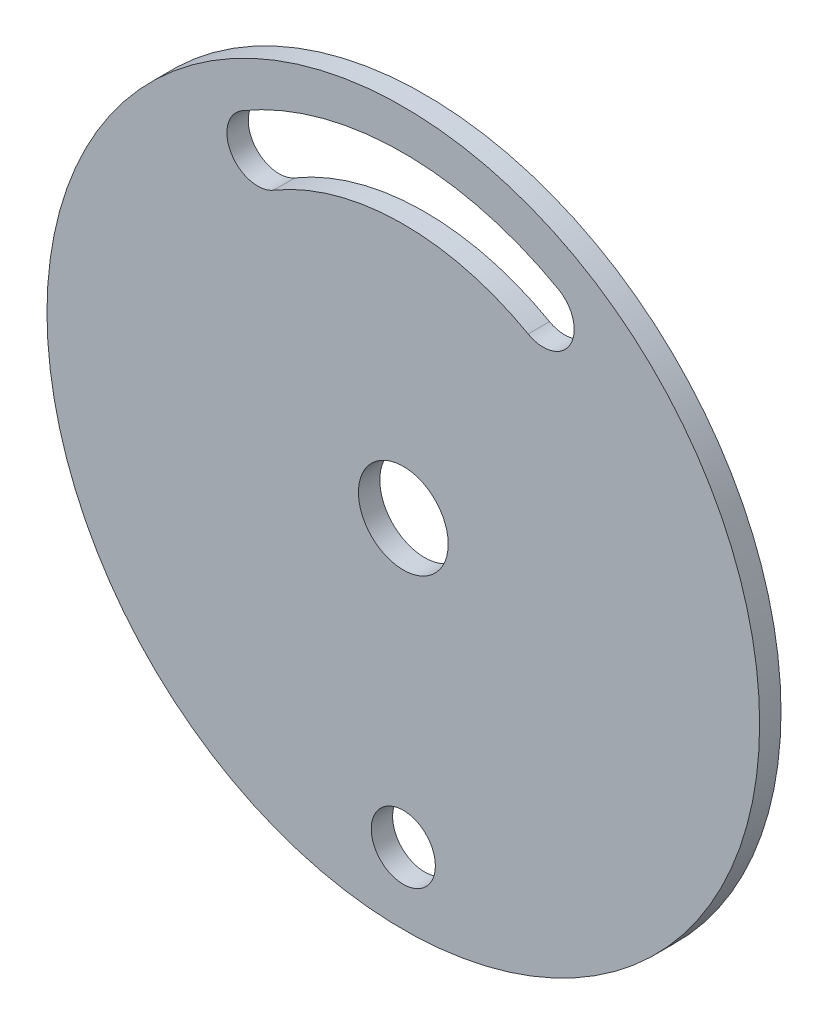
from build123d import *

# Parameters (mm, degrees)
SKETCH1_R           = 25
SKETCH1_R_2         = 2.25
BOSS_EXTRUDE1_DEPTH = 1.5


with BuildPart() as part:
    # Sketch1 → Boss-Extrude1 (new body)
    with BuildSketch(Plane.XY):
        with Locations((-2.056478496, 7.394811009)):
            Circle(SKETCH1_R)
        with Locations((-2.056478496, -12.605188991)):
            Circle(SKETCH1_R_2, mode=Mode.SUBTRACT)
        with BuildLine():
            ThreePointArc((-2.257963582, 25.260888974), (-6.874821844, 24.600069085), (-11.163369799, 22.76692436))
            ThreePointArc((-11.163369799, 22.76692436), (-14.132057019, 23.526738122), (-13.372243257, 26.495425342))
            ThreePointArc((-13.372243257, 26.495425342), (-8.066863393, 28.766644655), (-2.355342419, 29.593700179))
            ThreePointArc((-2.355342419, 29.593700179), (-2.305911076, 29.594310629), (-2.256478496, 29.594811009))
            ThreePointArc((-2.256478496, 29.594811009), (3.47218371, 28.89629687), (8.827256363, 26.744857922))
            ThreePointArc((8.827256363, 26.744857922), (9.653581953, 23.793992492), (6.702716524, 22.967666903))
            ThreePointArc((6.702716524, 22.967666903), (2.374062199, 24.70398913), (-2.256478496, 25.26090566))
            ThreePointArc((-2.256478496, 25.26090566), (-2.257221039, 25.260897332), (-2.257963582, 25.260888974))
        make_face(mode=Mode.SUBTRACT)
        with BuildLine():
            ThreePointArc((-3.662028612, 10.104923336), (-2.905892134, 10.428125446), (-2.09186952, 10.544612189))
            ThreePointArc((-2.09186952, 10.544612189), (0.158359904, 9.634675037), (1.093521504, 7.394811009))
            ThreePointArc((1.093521504, 7.394811009), (-3.616128638, 4.658026138), (-3.662028612, 10.104923336))
        make_face(mode=Mode.SUBTRACT)
    extrude(amount=BOSS_EXTRUDE1_DEPTH)


solid = part.part
